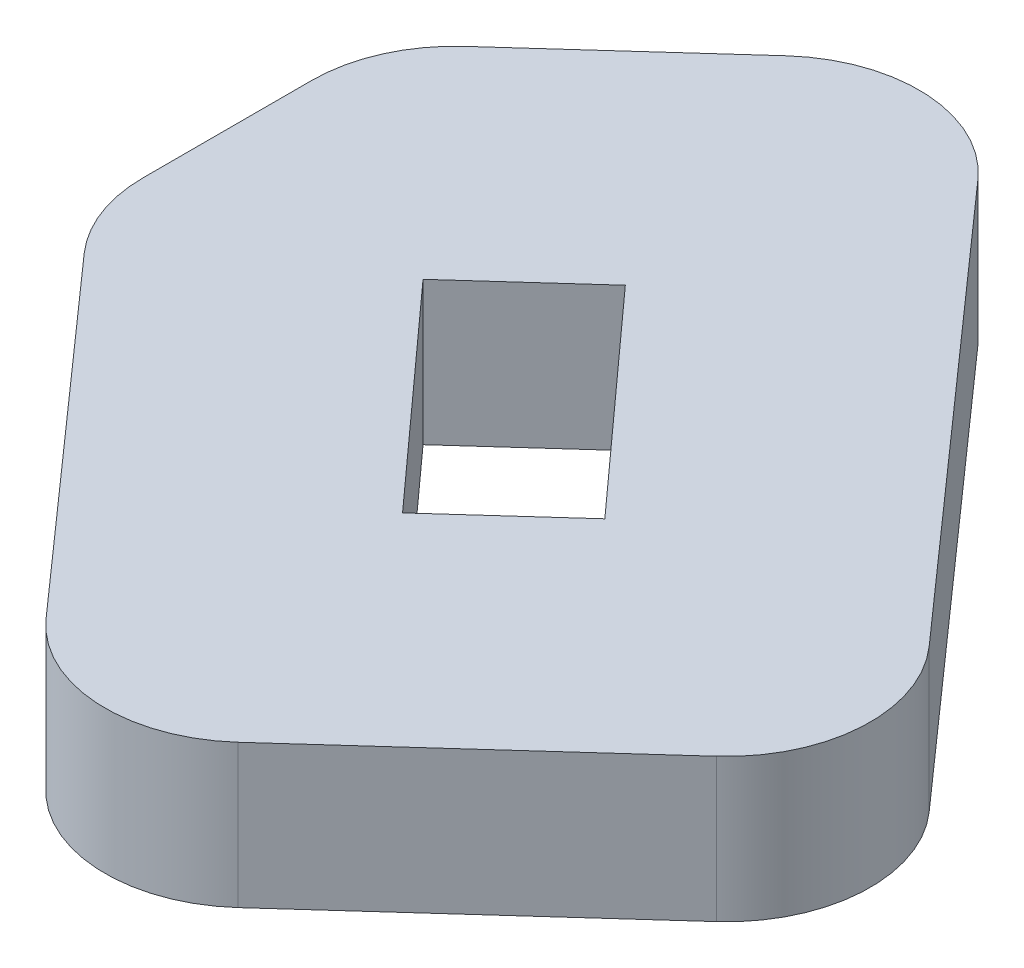
from build123d import *

# Parameters (mm, degrees)
STOCK_RECORD_START          = -3.175
STOCK_RECORD_NEEDLE_1_DEPTH = 3.175
FILLET1_R                   = 3.175
NEEDLE_HOLE_DEPTH           = 157.399949281


# Read off the part's stored shape, not the designer's step: Stock-Record Needle-1
with BuildPart() as part:
    # Stock-Record Needle-1 outline → Stock-Record Needle-1 (new body)
    with BuildSketch(Plane(origin=(0, 0, 0), x_dir=(1, 0, 0), z_dir=(0, 1, 0)).offset(STOCK_RECORD_START)):
        Polygon((-134.794168142, 66.899467737), (-141.955930631, 60.428744281), (-141.955930631, 54.078744281), (-132.445850386, 43.348439368), (-122.158808708, 52.642883574), align=None)
    extrude(amount=STOCK_RECORD_NEEDLE_1_DEPTH)

    # Fillet1
    fillet1_edges = [part.edges().sort_by_distance(p)[0] for p in [
        (-132.445850386, -1.5875, -43.348439368),
        (-122.158808708, -1.5875, -52.642883574),
        (-134.794168142, -1.5875, -66.899467737),
        (-141.955930631, -1.5875, -60.428744281),
        (-141.955930631, -1.5875, -54.078744281),
    ]]
    fillet(fillet1_edges, radius=FILLET1_R)

    # Needle Hole Sketch → Needle Hole (cut, through all)
    with BuildSketch(Plane.XZ.offset(3.175)):
        Polygon((-136.903920332, -56.435895918), (-132.646865427, -51.72421007), (-130.291022503, -53.852737522), (-134.548077408, -58.564423371), align=None)
    extrude(amount=-NEEDLE_HOLE_DEPTH, mode=Mode.SUBTRACT)


solid = part.part
